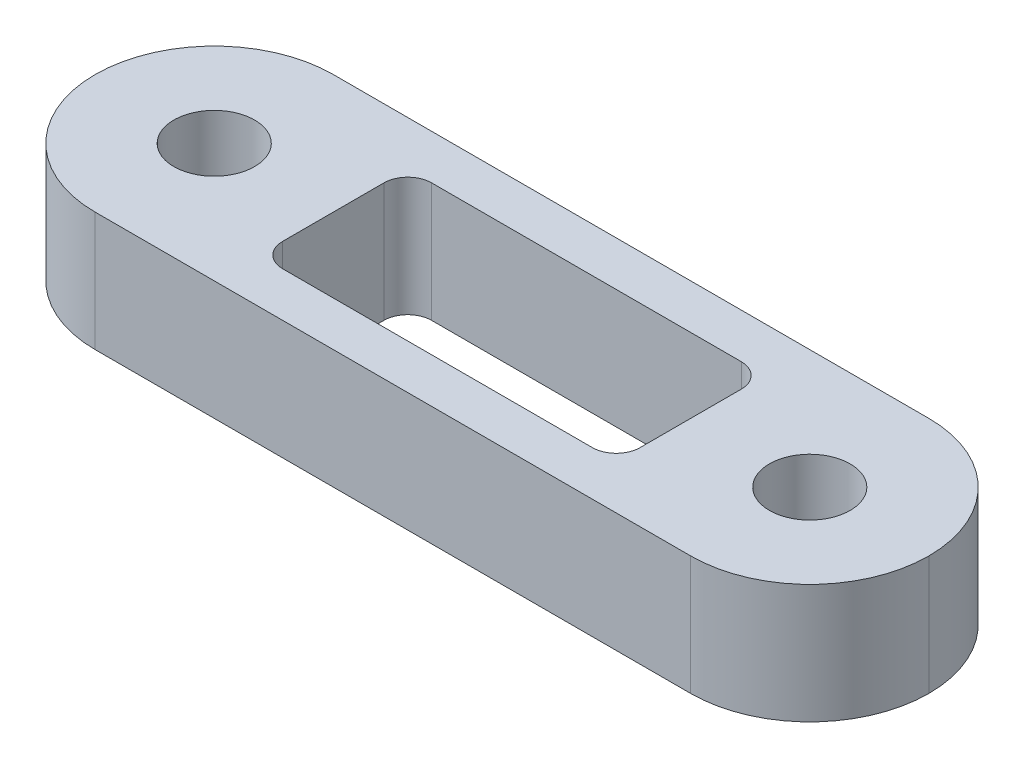
from build123d import *

# Parameters (mm, degrees)
SKETCH1_W                    = 44.45
SKETCH1_H                    = 12.7
BOSS_EXTRUDE4_DEPTH          = 6.35
FILLET3_R                    = 6.35
F_18_0_1695_DIAMETER_HOLE2_D = 4.3053
CUT_EXTRUDE1_DEPTH           = 6.35


with BuildPart() as part:
    # Sketch1 → Boss-Extrude4 (new body)
    with BuildSketch(Plane(origin=(0, 0, 0), x_dir=(1, 0, 0), z_dir=(0, 1, 0))):
        Rectangle(SKETCH1_W, SKETCH1_H)
    extrude(amount=BOSS_EXTRUDE4_DEPTH)

    # Fillet3
    fillet3_edges = [part.edges().sort_by_distance(p)[0] for p in [
        (22.225, 3.175, -6.35),
        (22.225, 3.175, 6.35),
        (-22.225, 3.175, -6.35),
        (-22.225, 3.175, 6.35),
    ]]
    fillet(fillet3_edges, radius=FILLET3_R - 0.0001)  # a hair under: the kernel refuses the full size

    # #18 (0.1695) Diameter Hole2 (through all)
    with Locations(Plane(origin=(0, 6.35, 0), x_dir=(1, 0, 0), z_dir=(0, 1, 0))):
        with Locations((-15.875, 0), (15.875, 0)):
            Hole(F_18_0_1695_DIAMETER_HOLE2_D / 2)

    # Sketch10 → Cut-Extrude1 (cut)
    with BuildSketch(Plane(origin=(0, 6.35, 0), x_dir=(1, 0, 0), z_dir=(0, 1, 0))):
        with BuildLine():
            Line((-8.255, 3.96875), (8.255, 3.96875))
            ThreePointArc((8.255, 3.96875), (9.153025612, 3.596775612), (9.525, 2.69875))
            Line((9.525, 2.69875), (9.525, -2.69875))
            ThreePointArc((9.525, -2.69875), (9.153025612, -3.596775612), (8.255, -3.96875))
            Line((8.255, -3.96875), (-8.255, -3.96875))
            ThreePointArc((-8.255, -3.96875), (-9.153025612, -3.596775612), (-9.525, -2.69875))
            Line((-9.525, -2.69875), (-9.525, 2.69875))
            ThreePointArc((-9.525, 2.69875), (-9.153025612, 3.596775612), (-8.255, 3.96875))
        make_face()
    extrude(amount=-CUT_EXTRUDE1_DEPTH, mode=Mode.SUBTRACT)


solid = part.part
